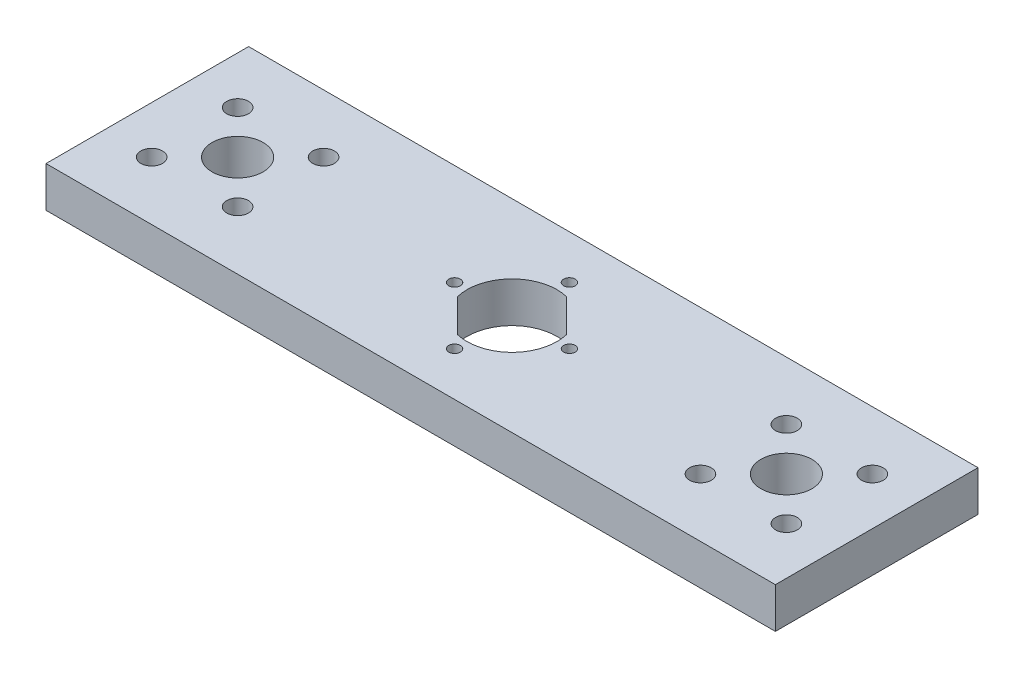
from build123d import *

# Parameters (mm, degrees)
SKETCH2_W           = 114.3
SKETCH2_H           = 31.75
SKETCH2_R           = 0.9115
SKETCH2_R_2         = 1.7
SKETCH2_R_3         = 4
BOSS_EXTRUDE1_DEPTH = 6.35


with BuildPart() as part:
    # Sketch2 → Boss-Extrude1 (new body)
    with BuildSketch(Plane(origin=(0, 0, 0), x_dir=(1, 0, 0), z_dir=(0, 1, 0))):
        Rectangle(SKETCH2_W, SKETCH2_H)
        with BuildLine():
            Line((1.758075393, 6.79791666), (6.79791666, 1.758075393))
            ThreePointArc((6.79791666, 1.758075393), (6.830865544, 1.714608205), (6.850845531, 1.663855614))
            ThreePointArc((6.850845531, 1.663855614), (4.985102807, -4.985102807), (-1.663855614, -6.850845531))
            ThreePointArc((-1.663855614, -6.850845531), (-1.714608205, -6.830865544), (-1.758075393, -6.79791666))
            Line((-1.758075393, -6.79791666), (-6.79791666, -1.758075393))
            ThreePointArc((-6.79791666, -1.758075393), (-6.830865544, -1.714608205), (-6.850845531, -1.663855614))
            ThreePointArc((-6.850845531, -1.663855614), (-4.985102807, 4.985102807), (1.663855614, 6.850845531))
            ThreePointArc((1.663855614, 6.850845531), (1.714608205, 6.830865544), (1.758075393, 6.79791666))
        make_face(mode=Mode.SUBTRACT)
        with Locations((0, 9.000000134)):
            Circle(SKETCH2_R, mode=Mode.SUBTRACT)
        with Locations((0, -9.000000134)):
            Circle(SKETCH2_R, mode=Mode.SUBTRACT)
        with Locations((9.000000134, 0)):
            Circle(SKETCH2_R, mode=Mode.SUBTRACT)
        with Locations((36.264808015, -6.735192091)):
            Circle(SKETCH2_R_2, mode=Mode.SUBTRACT)
        with Locations((49.735192197, -6.735192091)):
            Circle(SKETCH2_R_2, mode=Mode.SUBTRACT)
        with Locations((43.000000106, 0)):
            Circle(SKETCH2_R_3, mode=Mode.SUBTRACT)
        with Locations((36.264808015, 6.735192091)):
            Circle(SKETCH2_R_2, mode=Mode.SUBTRACT)
        with Locations((49.735192197, 6.735192091)):
            Circle(SKETCH2_R_2, mode=Mode.SUBTRACT)
        with Locations((-9.000000134, 0)):
            Circle(SKETCH2_R, mode=Mode.SUBTRACT)
        with Locations((-43.000000106, 0)):
            Circle(SKETCH2_R_3, mode=Mode.SUBTRACT)
        with Locations((-49.735192197, 6.735192091)):
            Circle(SKETCH2_R_2, mode=Mode.SUBTRACT)
        with Locations((-36.264808015, 6.735192091)):
            Circle(SKETCH2_R_2, mode=Mode.SUBTRACT)
        with Locations((-49.735192197, -6.735192091)):
            Circle(SKETCH2_R_2, mode=Mode.SUBTRACT)
        with Locations((-36.264808015, -6.735192091)):
            Circle(SKETCH2_R_2, mode=Mode.SUBTRACT)
    extrude(amount=BOSS_EXTRUDE1_DEPTH)


solid = part.part
